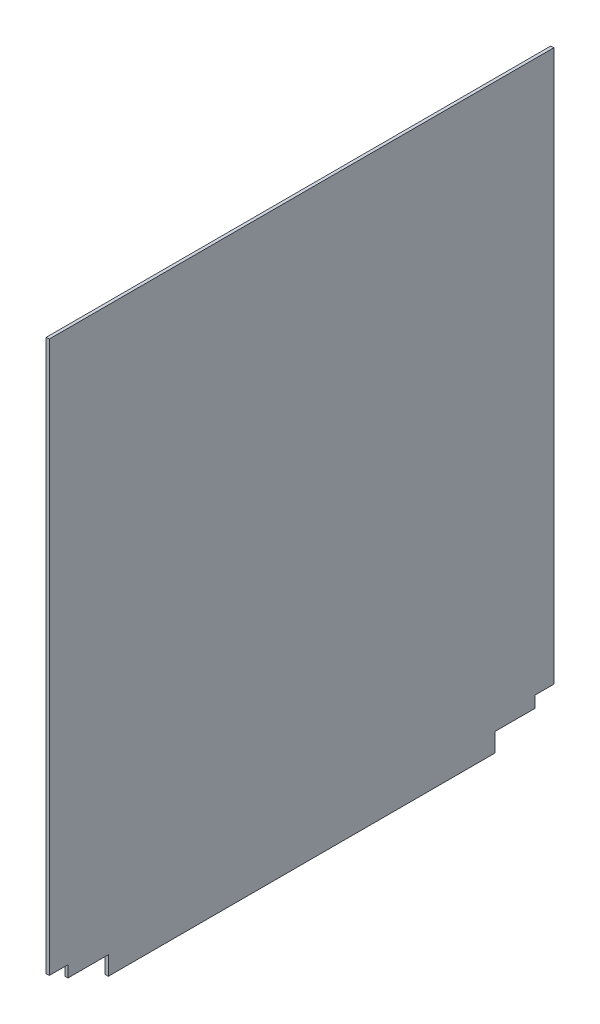
from build123d import *

# Parameters (mm, degrees)
SKETCH1_W           = 525.9
SKETCH1_H           = 606.075
BOSS_EXTRUDE1_DEPTH = 3.175
CAVITY1_DEPTH       = 3.175
SKETCH2_W           = 42
SKETCH2_H           = 19.5
CUT_EXTRUDE1_DEPTH  = 402.228749632


# Read off the part's stored shape, not the designer's step: Cavity1
with BuildPart() as part:
    # Sketch1 → Boss-Extrude1 (new body)
    with BuildSketch(Plane(origin=(0, 0, 0), x_dir=(0, 0, -1), z_dir=(1, 0, 0))):
        Rectangle(SKETCH1_W, SKETCH1_H)
    extrude(amount=BOSS_EXTRUDE1_DEPTH)

    # Cavity1 outline → Cavity1 (cut)
    with BuildSketch(Plane.YZ):
        Polygon((-301.162499999, 201.45), (-283.5375, 201.45), (-283.5375, 243.45), (-271.5375, 243.45), (-271.5375, 261.074999999), (-286.5375, 261.074999999), (-286.7875, 261.372938397), (-286.7875, 261.377061601), (-286.5375, 261.674999999), (-286.5375, 262.95), (-301.162499999, 262.95), align=None)
        Polygon((-271.5375, -261.074999999), (-271.5375, -243.45), (-283.5375, -243.45), (-283.5375, -201.45), (-301.162499999, -201.45), (-301.162499999, -262.95), (-286.5375, -262.95), (-286.5375, -261.674999999), (-286.7875, -261.377061601), (-286.7875, -261.372938397), (-286.5375, -261.074999999), align=None)
    extrude(amount=CAVITY1_DEPTH, mode=Mode.SUBTRACT)

    # Sketch2 → Cut-Extrude1 (cut, through all)
    with BuildSketch(Plane(origin=(3.175, 0, 0), x_dir=(0, 0, -1), z_dir=(1, 0, 0))):
        Polygon((-243.45, -283.5375), (-243.45, -271.5375), (-262.95, -271.5375), (-262.95, -303.0375), (-243.45, -303.0375), align=None)
        with Locations((-222.45, -293.2875)):
            Rectangle(SKETCH2_W, SKETCH2_H)
        Polygon((262.95, -271.5375), (243.45, -271.5375), (243.45, -283.5375), (243.45, -303.0375), (262.95, -303.0375), align=None)
        with Locations((222.45, -293.2875)):
            Rectangle(SKETCH2_W, SKETCH2_H)
    extrude(amount=-CUT_EXTRUDE1_DEPTH, mode=Mode.SUBTRACT)


solid = part.part
